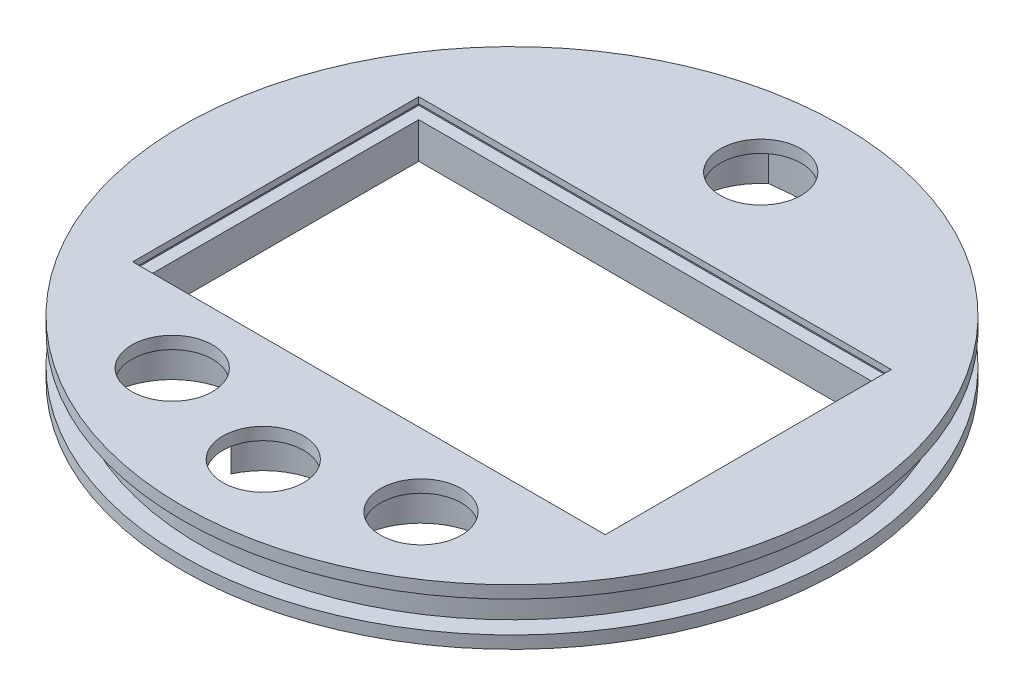
from build123d import *
from build123d.topology import SkipClean

# Parameters (mm, degrees)
SKETCH1_R           = 50
SKETCH1_R_2         = 6.5
SKETCH1_W           = 76
SKETCH1_H           = 46
BOSS_EXTRUDE1_DEPTH = 1
SKETCH2_R           = 50
SKETCH2_R_2         = 48.5
BOSS_EXTRUDE2_DEPTH = 7
SKETCH3_R           = 53
SKETCH3_R_2         = 50
BOSS_EXTRUDE3_DEPTH = 2
BOSS_EXTRUDE4_START = -7
SKETCH3_2_R         = 53
SKETCH3_2_R_2       = 50
BOSS_EXTRUDE4_DEPTH = 2
SKETCH5_W           = 76
SKETCH5_H           = 46
BOSS_EXTRUDE5_DEPTH = 7
SKETCH4_W           = 80
SKETCH4_H           = 50
CUT_EXTRUDE1_DEPTH  = 2.2


with BuildPart() as part:
    # Sketch1 → Boss-Extrude1 (new, symmetric)
    with BuildSketch(Plane(origin=(0, 0, 0), x_dir=(1, 0, 0), z_dir=(0, 1, 0))):
        with Locations(Location((0, 0, 0), (0, 0, 270))):
            Circle(SKETCH1_R)
        with Locations(Location((0, 40, 0), (0, 0, 270))):
            Circle(SKETCH1_R_2, mode=Mode.SUBTRACT)
        with Locations(Location((0, -40, 0), (0, 0, 270))):
            Circle(SKETCH1_R_2, mode=Mode.SUBTRACT)
        with Locations(Location((20, -34.641016151, 0), (0, 0, 270))):
            Circle(SKETCH1_R_2, mode=Mode.SUBTRACT)
        with Locations(Location((-20, -34.641016151, 0), (0, 0, 270))):
            Circle(SKETCH1_R_2, mode=Mode.SUBTRACT)
        Rectangle(SKETCH1_W, SKETCH1_H, mode=Mode.SUBTRACT)
    extrude(amount=BOSS_EXTRUDE1_DEPTH, both=True)

    # Sketch2 → Boss-Extrude2 (add)
    with SkipClean():  # the faces are left unmerged after this step: merging them gives an invalid solid
        with BuildSketch(Plane.XZ.offset(1)):
            with Locations(Location((0, 0, 0), (0, 0, 270))):
                Circle(SKETCH2_R)
            with Locations(Location((0, 0, 0), (0, 0, 270))):
                Circle(SKETCH2_R_2, mode=Mode.SUBTRACT)
        extrude(amount=BOSS_EXTRUDE2_DEPTH)

    # Sketch3 → Boss-Extrude3 (add)
    with BuildSketch(Plane(origin=(0, 1, 0), x_dir=(1, 0, 0), z_dir=(0, 1, 0))):
        with Locations(Location((0, 0, 0), (0, 0, 270))):
            Circle(SKETCH3_R)
        with Locations(Location((0, 0, 0), (0, 0, 90))):
            Circle(SKETCH3_R_2, mode=Mode.SUBTRACT)
    extrude(amount=-BOSS_EXTRUDE3_DEPTH)

    # Sketch3<2> → Boss-Extrude4 (add)
    with BuildSketch(Plane(origin=(0, 1, 0), x_dir=(1, 0, 0), z_dir=(0, 1, 0)).offset(BOSS_EXTRUDE4_START)):
        with Locations(Location((0, 0, 0), (0, 0, 270))):
            Circle(SKETCH3_2_R)
        with Locations(Location((0, 0, 0), (0, 0, 90))):
            Circle(SKETCH3_2_R_2, mode=Mode.SUBTRACT)
    extrude(amount=-BOSS_EXTRUDE4_DEPTH)

    # Sketch5 → Boss-Extrude5 (add, through all)
    with BuildSketch(Plane.XZ.offset(1)):
        with BuildLine():
            ThreePointArc((29.876545638, 38.205261689), (21.320536736, 24.224386047), (9.54648854, 35.627980267))
            ThreePointArc((9.54648854, 35.627980267), (0, 29.5), (-9.54648854, 35.627980267))
            ThreePointArc((-9.54648854, 35.627980267), (-21.320536736, 24.224386047), (-29.876545638, 38.205261689))
            ThreePointArc((-29.876545638, 38.205261689), (-46.847402575, -12.552723687), (-6.771216656, -48.025))
            ThreePointArc((-6.771216656, -48.025), (0, -29.5), (6.771216656, -48.025))
            ThreePointArc((6.771216656, -48.025), (46.847402575, -12.552723687), (29.876545638, 38.205261689))
        make_face()
        Rectangle(SKETCH5_W, SKETCH5_H, mode=Mode.SUBTRACT)
    extrude(amount=BOSS_EXTRUDE5_DEPTH)

    # Sketch4 → Cut-Extrude1 (cut)
    with BuildSketch(Plane(origin=(0, 0, 0), x_dir=(1, 0, 0), z_dir=(0, 1, 0))):
        Rectangle(SKETCH4_W, SKETCH4_H)
    extrude(amount=-CUT_EXTRUDE1_DEPTH, mode=Mode.SUBTRACT)


solid = part.part
